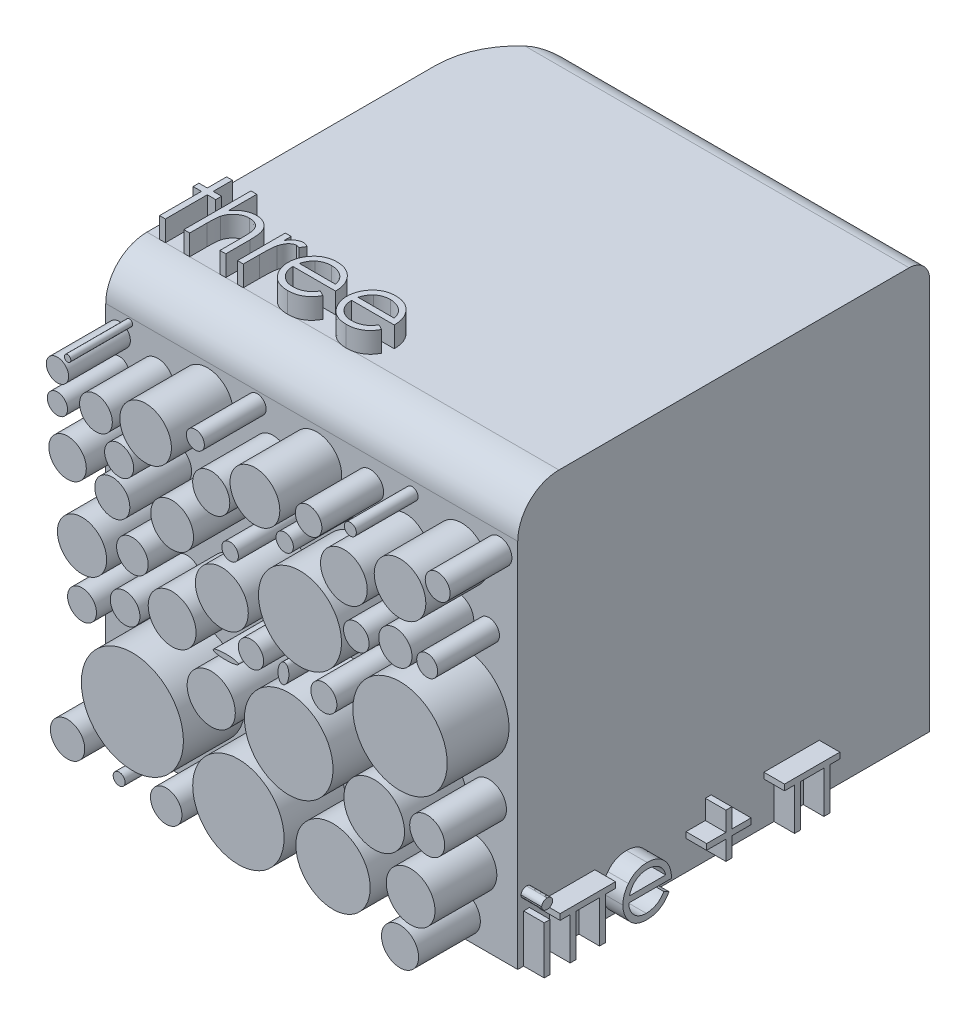
from build123d import *
from OCP.BRepFilletAPI import BRepFilletAPI_MakeFillet

# Parameters (mm, degrees)
SKETCH2_W           = 20
SKETCH2_H           = 20
BOSS_EXTRUDE1_DEPTH = 20
SKETCH3_W           = 0.284935898
SKETCH3_H           = 2.320192308
BOSS_EXTRUDE2_DEPTH = 1
FILLET1_R1          = 2
FILLET1_R2          = 1
FILLET1_R3          = 4
BOSS_EXTRUDE3_DEPTH = 1
SKETCH5_R           = 0.869274054
SKETCH5_R_2         = 1.87334708
SKETCH5_R_3         = 1.224259222
SKETCH5_R_4         = 0.854359486
SKETCH5_R_5         = 0.723058737
SKETCH5_R_6         = 0.828150602
SKETCH5_R_7         = 1.20534194
SKETCH5_R_8         = 2.196982283
SKETCH5_R_9         = 1.648859169
SKETCH5_R_10        = 0.887298728
SKETCH5_R_11        = 1.198491665
SKETCH5_R_12        = 1.240938395
SKETCH5_R_13        = 1.52286101
SKETCH5_R_14        = 2.08407997
SKETCH5_R_15        = 1.116428312
SKETCH5_R_16        = 0.510356374
SKETCH5_R_17        = 0.928303522
SKETCH5_R_18        = 1.048285303
SKETCH5_R_19        = 1.120954627
SKETCH5_R_20        = 1.035138007
SKETCH5_R_21        = 1.063032749
SKETCH5_R_22        = 0.901829478
SKETCH5_R_23        = 0.83084329
SKETCH5_R_24        = 0.806786337
SKETCH5_R_25        = 0.775997991
SKETCH5_R_26        = 0.848871038
SKETCH5_R_27        = 0.739481873
SKETCH5_R_28        = 1.066466648
SKETCH5_R_29        = 0.843889534
SKETCH5_R_30        = 0.704115082
SKETCH5_R_31        = 0.319725843
SKETCH5_R_32        = 0.681387214
SKETCH5_R_33        = 0.790534868
SKETCH5_R_34        = 0.573713006
SKETCH5_R_35        = 0.533233324
SKETCH5_R_36        = 0.625054899
SKETCH5_R_37        = 0.340042365
SKETCH5_R_38        = 0.519725647
SKETCH5_R_39        = 0.813729973
SKETCH5_R_40        = 0.720290961
SKETCH5_R_41        = 0.811333119
SKETCH5_R_42        = 0.907849135
SKETCH5_R_43        = 0.760866236
SKETCH5_R_44        = 0.443440105
SKETCH5_R_45        = 0.505502597
SKETCH5_R_46        = 0.653372918
SKETCH5_R_47        = 0.821463246
SKETCH5_R_48        = 0.243410693
SKETCH5_R_49        = 0.331818637
SKETCH5_R_50        = 0.58557289
SKETCH5_R_51        = 0.913548579
SKETCH5_R_52        = 0.618089992
SKETCH5_R_53        = 0.33645039
SKETCH5_R_54        = 0.353045631
SKETCH5_R_55        = 0.558214156
SKETCH5_R_56        = 0.708578995
SKETCH5_R_57        = 0.386937988
SKETCH5_R_58        = 0.620695254
SKETCH5_R_59        = 0.450911284
SKETCH5_R_60        = 0.446571325
SKETCH5_R_61        = 0.637073751
SKETCH5_R_62        = 0.354108624
SKETCH5_R_63        = 0.719749999
SKETCH5_RX          = 0.571418379
SKETCH5_RY          = 0.334928494
BOSS_EXTRUDE4_DEPTH = 4
SKETCH6_R           = 0.794272448
SKETCH6_R_2         = 0.85045789
SKETCH6_R_3         = 0.901030327
SKETCH6_R_4         = 1.16174239
SKETCH6_R_5         = 1.038098205
SKETCH6_R_6         = 2.014765062
SKETCH6_R_7         = 2.14961737
SKETCH6_R_8         = 2.477089822
SKETCH6_R_9         = 1.183351901
SKETCH6_R_10        = 2.217815956
SKETCH6_R_11        = 1.803840094
SKETCH6_R_12        = 1.195092222
SKETCH6_R_13        = 0.702366469
SKETCH6_R_14        = 1.252556633
SKETCH6_R_15        = 2.290309651
SKETCH6_R_16        = 1.471259211
SKETCH6_R_17        = 1.284780558
SKETCH6_R_18        = 1.169284811
SKETCH6_R_19        = 0.719100487
SKETCH6_R_20        = 0.910166483
SKETCH6_R_21        = 1.250904183
SKETCH6_R_22        = 0.643183028
SKETCH6_R_23        = 1.207146771
SKETCH6_R_24        = 1.133501294
SKETCH6_R_25        = 0.806547414
SKETCH6_R_26        = 0.403167986
SKETCH6_R_27        = 0.767115422
SKETCH6_R_28        = 0.492725753
SKETCH6_R_29        = 0.157493034
SKETCH6_R_30        = 0.541714877
SKETCH6_R_31        = 0.436948105
SKETCH6_R_32        = 0.614399725
SKETCH6_R_33        = 0.834280538
SKETCH6_R_34        = 0.764414303
SKETCH6_R_35        = 0.289432363
SKETCH6_R_36        = 0.90045624
SKETCH6_R_37        = 0.84902596
SKETCH6_R_38        = 0.633160864
SKETCH6_R_39        = 0.705305254
SKETCH6_R_40        = 0.508480831
SKETCH6_R_41        = 0.621454766
SKETCH6_R_42        = 0.603096786
SKETCH6_R_43        = 0.422088862
SKETCH6_RX          = 0.486141315
SKETCH6_RY          = 0.259275368
SKETCH6_RX_2        = 0.611023877
SKETCH6_RY_2        = 0.128636606
BOSS_EXTRUDE5_DEPTH = 3


with BuildPart() as part:
    # Sketch2 → Boss-Extrude1 (new body)
    with BuildSketch(Plane(origin=(0, 0, 0), x_dir=(1, 0, 0), z_dir=(0, 1, 0))):
        with Locations((10, -10)):
            Rectangle(SKETCH2_W, SKETCH2_H)
    extrude(amount=BOSS_EXTRUDE1_DEPTH)

    # Sketch3 → Boss-Extrude2 (add)
    # profile 1 of 6: a face of its own
    with BuildSketch(Plane(origin=(20, 0, 0), x_dir=(0, 0, -1), z_dir=(1, 0, 0))):
        with BuildLine():
            add(Edge.make_bspline(
                [(-19.573868189, 3.297115385), (-19.556186781, 3.296295189), (-19.521563189, 3.294689089), (-19.47149501, 3.280935463), (-19.425904721, 3.257622177), (-19.385466349, 3.226344181), (-19.350766423, 3.189560043), (-19.326472493, 3.146687593), (-19.310858391, 3.100370114), (-19.308972844, 3.06806214), (-19.308012821, 3.05161258)],
                knots=[0, 0, 0, 0, 1.055194115, 2.066272739, 3.074728998, 4.095836921, 5.109056067, 6.073838105, 7.019297344, 8, 8, 8, 8], degree=3))
            add(Edge.make_bspline(
                [(-19.308012821, 3.05161258), (-19.308994494, 3.03559003), (-19.310935147, 3.003915346), (-19.326460432, 2.958400839), (-19.350973462, 2.916124096), (-19.385444098, 2.879411381), (-19.425910617, 2.848150675), (-19.471493444, 2.824832805), (-19.521563601, 2.811080395), (-19.55618692, 2.809474127), (-19.573868189, 2.808653846)],
                knots=[0, 0, 0, 0, 0.96129708, 1.900370562, 2.859976407, 3.87933698, 4.906634145, 5.921202961, 6.938410037, 8, 8, 8, 8], degree=3))
            add(Edge.make_bspline(
                [(-19.573868189, 2.808653846), (-19.591347267, 2.809442807), (-19.625368009, 2.810978415), (-19.674686502, 2.825102646), (-19.71988806, 2.848158655), (-19.760405299, 2.879206694), (-19.794178403, 2.916349565), (-19.818760455, 2.958375039), (-19.834249885, 3.003921915), (-19.836195369, 3.035592237), (-19.837179487, 3.05161258)],
                knots=[0, 0, 0, 0, 1.054934014, 2.053291228, 3.073705704, 4.106921865, 5.123545215, 6.088680038, 7.033164197, 8, 8, 8, 8], degree=3))
            add(Edge.make_bspline(
                [(-19.837179487, 3.05161258), (-19.83621693, 3.068059851), (-19.834326407, 3.100363328), (-19.818748845, 3.146713822), (-19.794383162, 3.189332756), (-19.760382936, 3.226548745), (-19.719894012, 3.257614247), (-19.674684964, 3.280665637), (-19.625368416, 3.294791066), (-19.591347405, 3.296326509), (-19.573868189, 3.297115385)],
                knots=[0, 0, 0, 0, 0.98631895, 1.937192651, 2.907499808, 3.917963147, 4.944918757, 5.95915025, 6.951458133, 8, 8, 8, 8], degree=3))
        make_face()
    # profile 2 of 6: a face of its own
    with BuildSketch(Plane(origin=(20, 0, 0), x_dir=(0, 0, -1), z_dir=(1, 0, 0))):
        with Locations((-19.572596154, 1.160096154)):
            Rectangle(SKETCH3_W, SKETCH3_H)
    # profile 3 of 6: a face of its own
    with BuildSketch(Plane(origin=(20, 0, 0), x_dir=(0, 0, -1), z_dir=(1, 0, 0))):
        Polygon((-16.256585145, 2.03525641), (-16.745046683, 2.03525641), (-16.745046683, 0), (-17.029982581, 0), (-17.029982581, 2.03525641), (-18.169726171, 2.03525641), (-18.169726171, 0), (-18.454662068, 0), (-18.454662068, 2.03525641), (-18.943123606, 2.03525641), (-18.943123606, 2.320192308), (-16.256585145, 2.320192308), align=None)
    # profile 4 of 6: a face of its own
    with BuildSketch(Plane(origin=(20, 0, 0), x_dir=(0, 0, -1), z_dir=(1, 0, 0))):
        with BuildLine():
            Line((-13.909152811, 0.732692308), (-13.656017795, 0.599764623))
            add(Edge.make_bspline(
                [(-13.656017795, 0.599764623), (-13.676189563, 0.563983887), (-13.715435837, 0.494368744), (-13.782927944, 0.398726985), (-13.853677895, 0.312686557), (-13.930879352, 0.238546085), (-14.012222561, 0.1739109), (-14.098158612, 0.117361587), (-14.189134897, 0.069175501), (-14.285155718, 0.028578565), (-14.387027454, -0.002635762), (-14.494996972, -0.024683162), (-14.609271115, -0.038311413), (-14.687599435, -0.039894505), (-14.727707498, -0.040705128)],
                knots=[0, 0, 0, 0, 1.120438281, 2.179929193, 3.190490725, 4.156257408, 5.095198341, 6.022838206, 6.959905092, 7.901321166, 8.864066838, 9.862729781, 10.905609505, 12, 12, 12, 12], degree=3))
            add(Edge.make_bspline(
                [(-14.727707498, -0.040705128), (-14.772286292, -0.039664476), (-14.859246605, -0.037634466), (-14.985829089, -0.020133445), (-15.10500899, 0.008416481), (-15.216779607, 0.048299508), (-15.320867222, 0.100394295), (-15.417478712, 0.163857539), (-15.507122139, 0.238363227), (-15.586972671, 0.324556715), (-15.658858193, 0.416796776), (-15.722290902, 0.5129139), (-15.775320143, 0.612666254), (-15.818457153, 0.7154188), (-15.853295852, 0.820523904), (-15.877577076, 0.928937878), (-15.891574062, 1.040367301), (-15.893718952, 1.115748455), (-15.894799846, 1.153735978)],
                knots=[0, 0, 0, 0, 1.145258523, 2.234067595, 3.276747158, 4.290159414, 5.277019952, 6.260822364, 7.254936242, 8.264827045, 9.274100331, 10.257902744, 11.220704747, 12.172965371, 13.118907548, 14.062713208, 15.023725156, 16, 16, 16, 16], degree=3))
            add(Edge.make_bspline(
                [(-15.894799846, 1.153735978), (-15.893839054, 1.189382002), (-15.89193489, 1.260027716), (-15.879932675, 1.364590031), (-15.858661724, 1.466215842), (-15.829473201, 1.564989591), (-15.791780285, 1.660745898), (-15.745668201, 1.753543042), (-15.691065115, 1.843282276), (-15.648907761, 1.899890833), (-15.627672442, 1.928405449)],
                knots=[0, 0, 0, 0, 1.024358464, 2.0301432, 3.019427413, 4.004406732, 4.986367066, 5.972626655, 6.978780325, 8, 8, 8, 8], degree=3))
            add(Edge.make_bspline(
                [(-15.627672442, 1.928405449), (-15.598909044, 1.962757924), (-15.5422934, 2.030374674), (-15.446538706, 2.119218727), (-15.342852099, 2.193644152), (-15.232532981, 2.25533634), (-15.11429918, 2.302211719), (-14.989740037, 2.337143598), (-14.857437256, 2.356717936), (-14.766990377, 2.359482757), (-14.720711304, 2.360897436)],
                knots=[0, 0, 0, 0, 1.030682036, 2.02871468, 2.997146059, 3.962720338, 4.930598197, 5.918074684, 6.934738563, 8, 8, 8, 8], degree=3))
            add(Edge.make_bspline(
                [(-14.720711304, 2.360897436), (-14.673133834, 2.35966912), (-14.579797682, 2.357259445), (-14.443697115, 2.334919842), (-14.314918465, 2.299493596), (-14.193513265, 2.249461229), (-14.079469206, 2.18490935), (-13.973527575, 2.104952108), (-13.87387656, 2.012044272), (-13.815902349, 1.940594789), (-13.786401409, 1.904236779)],
                knots=[0, 0, 0, 0, 1.056321875, 2.072262726, 3.055038591, 4.01806755, 4.982017516, 5.957941055, 6.960871419, 8, 8, 8, 8], degree=3))
            add(Edge.make_bspline(
                [(-13.786401409, 1.904236779), (-13.766329115, 1.876837816), (-13.726318134, 1.822222265), (-13.676201121, 1.733167001), (-13.632696913, 1.639993819), (-13.597923441, 1.541196621), (-13.56976618, 1.437946002), (-13.549394637, 1.329503836), (-13.537447911, 1.215902417), (-13.535099593, 1.138499042), (-13.53390241, 1.099038462)],
                knots=[0, 0, 0, 0, 0.94817472, 1.890038105, 2.849395472, 3.817997239, 4.812318967, 5.836947057, 6.897266129, 8, 8, 8, 8], degree=3))
            Line((-13.53390241, 1.099038462), (-15.609863949, 1.099038462))
            add(Edge.make_bspline(
                [(-15.609863949, 1.099038462), (-15.608467306, 1.068467326), (-15.605720864, 1.008350421), (-15.592916412, 0.920384068), (-15.572733596, 0.836588251), (-15.544368089, 0.757591491), (-15.510017451, 0.682362018), (-15.467938979, 0.611457885), (-15.417738098, 0.545202048), (-15.361744071, 0.483001859), (-15.29941692, 0.427611026), (-15.233846142, 0.378034057), (-15.164092694, 0.336481837), (-15.090706576, 0.302754366), (-15.013806456, 0.276350779), (-14.933368108, 0.258327828), (-14.849549816, 0.246256381), (-14.792412758, 0.244914113), (-14.763324485, 0.244230769)],
                knots=[0, 0, 0, 0, 1.094153842, 2.151609401, 3.174256925, 4.172055639, 5.149267565, 6.128595816, 7.11444997, 8.118368179, 9.117203808, 10.09244225, 11.054858984, 12.015122123, 12.976791628, 13.957293641, 14.960065497, 16, 16, 16, 16], degree=3))
            add(Edge.make_bspline(
                [(-14.763324485, 0.244230769), (-14.734884516, 0.244782363), (-14.678454161, 0.245876832), (-14.594415669, 0.256519351), (-14.511739097, 0.273728102), (-14.430766634, 0.297214021), (-14.353141652, 0.325858737), (-14.281254617, 0.360423472), (-14.21514185, 0.398659314), (-14.153350031, 0.442392376), (-14.093414201, 0.495921231), (-14.033957803, 0.56271935), (-13.970206839, 0.641720179), (-13.930301994, 0.701179461), (-13.909152811, 0.732692308)],
                knots=[0, 0, 0, 0, 0.99110716, 1.966546729, 2.947904876, 3.932708344, 4.903319531, 5.828989031, 6.710028674, 7.56322171, 8.463672341, 9.504779593, 10.677557249, 12, 12, 12, 12], degree=3))
        make_face()
        with BuildLine():
            add(Edge.make_bspline(
                [(-13.818838308, 1.383974359), (-13.829267388, 1.421768537), (-13.849340012, 1.494510165), (-13.891283, 1.595240115), (-13.938519326, 1.68476414), (-13.994419039, 1.762397092), (-14.057754598, 1.831343136), (-14.130911299, 1.891594282), (-14.212949574, 1.945494398), (-14.303445366, 1.990989879), (-14.399277556, 2.02971568), (-14.499613173, 2.055682749), (-14.60199131, 2.073471405), (-14.671237412, 2.075127947), (-14.706082899, 2.075961538)],
                knots=[0, 0, 0, 0, 1.154881502, 2.222775134, 3.210006277, 4.132804581, 5.035138423, 5.962687519, 6.919655026, 7.923214229, 8.944639381, 9.960483929, 10.97369054, 12, 12, 12, 12], degree=3))
            add(Edge.make_bspline(
                [(-14.706082899, 2.075961538), (-14.734521318, 2.075406665), (-14.790738094, 2.074309797), (-14.873561206, 2.063904751), (-14.953099219, 2.046705463), (-15.029939015, 2.023151538), (-15.10307366, 1.991756592), (-15.174007485, 1.954941807), (-15.240936845, 1.910000514), (-15.282793592, 1.875747838), (-15.303939469, 1.85844351)],
                knots=[0, 0, 0, 0, 1.04873581, 2.073130211, 3.073294108, 4.04793562, 5.032784715, 6.005352987, 6.992311501, 8, 8, 8, 8], degree=3))
            add(Edge.make_bspline(
                [(-15.303939469, 1.85844351), (-15.319082661, 1.844750809), (-15.34972879, 1.81704012), (-15.390677691, 1.769297911), (-15.429884835, 1.717816137), (-15.465566077, 1.660625203), (-15.498293602, 1.598376353), (-15.528918724, 1.531594641), (-15.55648354, 1.459773302), (-15.571992154, 1.409724017), (-15.57997112, 1.383974359)],
                knots=[0, 0, 0, 0, 0.879870761, 1.780643979, 2.707998968, 3.669668524, 4.684282772, 5.740141944, 6.837334558, 8, 8, 8, 8], degree=3))
            Line((-15.57997112, 1.383974359), (-13.818838308, 1.383974359))
        make_face(mode=Mode.SUBTRACT)
    # profile 5 of 6: a face of its own
    with BuildSketch(Plane(origin=(20, 0, 0), x_dir=(0, 0, -1), z_dir=(1, 0, 0))):
        Polygon((-10.894403598, 1.709615385), (-10.894403598, 2.645833333), (-10.6094677, 2.645833333), (-10.6094677, 1.709615385), (-9.673249751, 1.709615385), (-9.673249751, 1.424679487), (-10.6094677, 1.424679487), (-10.6094677, 0.488461538), (-10.894403598, 0.488461538), (-10.894403598, 1.424679487), (-11.830621546, 1.424679487), (-11.830621546, 1.709615385), align=None)
    # profile 6 of 6: a face of its own
    with BuildSketch(Plane(origin=(20, 0, 0), x_dir=(0, 0, -1), z_dir=(1, 0, 0))):
        Polygon((-5.364587302, 2.03525641), (-5.85304884, 2.03525641), (-5.85304884, 0), (-6.137984738, 0), (-6.137984738, 2.03525641), (-7.277728327, 2.03525641), (-7.277728327, 0), (-7.562664225, 0), (-7.562664225, 2.03525641), (-8.051125763, 2.03525641), (-8.051125763, 2.320192308), (-5.364587302, 2.320192308), align=None)
    extrude(amount=BOSS_EXTRUDE2_DEPTH)

    # Fillet1: one fillet with a radius per group of edges: ONE call of the kernel's fillet builder (fillet() takes one radius for all edges)
    fillet1_edges_1 = [part.edges().sort_by_distance(p)[0] for p in [
        (10, 20, 20),
    ]]
    fillet1_edges_2 = [part.edges().sort_by_distance(p)[0] for p in [
        (10, 20, 0),
    ]]
    fillet1_edges_3 = [part.edges().sort_by_distance(p)[0] for p in [
        (0, 10, 0),
    ]]
    fillet1 = BRepFilletAPI_MakeFillet(part.part.solid().wrapped)
    for e in fillet1_edges_1:
        fillet1.Add(FILLET1_R1, e.wrapped)
    for e in fillet1_edges_2:
        fillet1.Add(FILLET1_R2, e.wrapped)
    for e in fillet1_edges_3:
        fillet1.Add(FILLET1_R3, e.wrapped)
    add(Compound.cast(fillet1.Shape()), mode=Mode.REPLACE)

    # Sketch4 → Boss-Extrude3 (add)
    # profile 1 of 5: a face of its own
    with BuildSketch(Plane(origin=(0, 20, 0), x_dir=(1, 0, 0), z_dir=(0, 1, 0))):
        Polygon((0.610576923, -14.743589744), (0.895512821, -14.743589744), (0.895512821, -15.679807692), (1.302564103, -15.679807692), (1.302564103, -15.96474359), (0.895512821, -15.96474359), (0.895512821, -18), (0.610576923, -18), (0.610576923, -15.96474359), (0.203525641, -15.96474359), (0.203525641, -15.679807692), (0.610576923, -15.679807692), align=None)
    # profile 2 of 5: a face of its own
    with BuildSketch(Plane(origin=(0, 20, 0), x_dir=(1, 0, 0), z_dir=(0, 1, 0))):
        with BuildLine():
            Line((1.791025641, -14.743589744), (2.075961538, -14.743589744))
            Line((2.075961538, -14.743589744), (2.075961538, -16.118023838))
            add(Edge.make_bspline(
                [(2.075961538, -16.118023838), (2.106547948, -16.079793226), (2.166101254, -16.005356265), (2.266337017, -15.90823647), (2.369271308, -15.824054864), (2.478459386, -15.757043806), (2.591898072, -15.704106085), (2.710065807, -15.666561577), (2.832984545, -15.643473796), (2.916464502, -15.640572374), (2.958754006, -15.639102564)],
                knots=[0, 0, 0, 0, 1.125788106, 2.19196713, 3.20547328, 4.180437432, 5.132270164, 6.079753143, 7.027236121, 8, 8, 8, 8], degree=3))
            add(Edge.make_bspline(
                [(2.958754006, -15.639102564), (3.001689434, -15.640685919), (3.085724423, -15.643784926), (3.208081178, -15.668289921), (3.322345686, -15.710161311), (3.428178272, -15.767462827), (3.523269248, -15.83883032), (3.607497248, -15.921227487), (3.676295687, -16.01672597), (3.723103457, -16.104951286), (3.753559334, -16.183454299), (3.772837777, -16.250797421), (3.789183764, -16.325838013), (3.803425667, -16.408537449), (3.81291763, -16.499292712), (3.82054182, -16.597694357), (3.825963317, -16.703736743), (3.826173416, -16.777142969), (3.826282051, -16.815099159)],
                knots=[0, 0, 0, 0, 1.235656852, 2.418478516, 3.575258207, 4.727955599, 5.870717718, 6.98870536, 8.107142894, 9.245821548, 9.854588956, 10.528768408, 11.260415777, 12.065282286, 12.943670737, 13.886611085, 14.907229059, 16, 16, 16, 16], degree=3))
            Line((3.826282051, -16.815099159), (3.826282051, -18))
            Line((3.826282051, -18), (3.541346154, -18))
            Line((3.541346154, -18), (3.541346154, -16.90859375))
            add(Edge.make_bspline(
                [(3.541346154, -16.90859375), (3.541173522, -16.877004614), (3.540843306, -16.816579973), (3.5397517, -16.730069289), (3.537314919, -16.651604938), (3.53337717, -16.581438389), (3.529235784, -16.519471821), (3.523535918, -16.465795221), (3.516904491, -16.420334868), (3.510945668, -16.392971241), (3.508273237, -16.380699119)],
                knots=[0, 0, 0, 0, 1.430932559, 2.737130458, 3.918967929, 4.986496826, 5.920444988, 6.731744033, 7.431208747, 8, 8, 8, 8], degree=3))
            add(Edge.make_bspline(
                [(3.508273237, -16.380699119), (3.497909815, -16.344690751), (3.477986196, -16.275464874), (3.431678388, -16.181428259), (3.373839856, -16.101250672), (3.303221269, -16.03601414), (3.221071896, -15.984840815), (3.126856071, -15.949400755), (3.021460524, -15.927404607), (2.947209546, -15.925191811), (2.908508614, -15.924038462)],
                knots=[0, 0, 0, 0, 1.090059168, 2.095632401, 3.037101401, 3.955032261, 4.878929692, 5.839099886, 6.873700383, 8, 8, 8, 8], degree=3))
            add(Edge.make_bspline(
                [(2.908508614, -15.924038462), (2.885587134, -15.924470104), (2.840226117, -15.925324313), (2.772962685, -15.93390035), (2.707712748, -15.947914544), (2.643847916, -15.966877947), (2.582721729, -15.992682113), (2.522552463, -16.022554499), (2.465044859, -16.059119844), (2.409177725, -16.100146076), (2.357182534, -16.145566501), (2.308807222, -16.193506239), (2.265683157, -16.244555671), (2.226613792, -16.297895776), (2.192887776, -16.354258189), (2.163448194, -16.413099392), (2.138469384, -16.474496767), (2.126057227, -16.517109858), (2.119846755, -16.53843149)],
                knots=[0, 0, 0, 0, 1.024319606, 2.027102035, 3.025350316, 4.005802111, 5.00026367, 5.987881639, 7.005602596, 8.042517216, 9.083927026, 10.089214625, 11.084353441, 12.06828073, 13.041928858, 14.016821737, 15.00770877, 16, 16, 16, 16], degree=3))
            add(Edge.make_bspline(
                [(2.119846755, -16.53843149), (2.116273132, -16.553871924), (2.108485767, -16.587518531), (2.100035882, -16.643012382), (2.092472309, -16.707497876), (2.086078268, -16.780877207), (2.082156611, -16.863419262), (2.077930921, -16.954560775), (2.076357923, -17.054872651), (2.076097615, -17.124627861), (2.075961538, -17.161092748)],
                knots=[0, 0, 0, 0, 0.607992626, 1.324890765, 2.152360218, 3.099583803, 4.150613268, 5.323148443, 6.60066238, 8, 8, 8, 8], degree=3))
            Line((2.075961538, -17.161092748), (2.075961538, -18))
            Line((2.075961538, -18), (1.791025641, -18))
            Line((1.791025641, -18), (1.791025641, -14.743589744))
        make_face()
    # profile 3 of 5: a face of its own
    with BuildSketch(Plane(origin=(0, 20, 0), x_dir=(1, 0, 0), z_dir=(0, 1, 0))):
        with BuildLine():
            Line((4.396153846, -15.679807692), (4.681089744, -15.679807692))
            Line((4.681089744, -15.679807692), (4.681089744, -16.021349159))
            add(Edge.make_bspline(
                [(4.681089744, -16.021349159), (4.70212526, -15.989548514), (4.742355523, -15.928730029), (4.80922368, -15.848294306), (4.877715988, -15.781696371), (4.948160337, -15.728625322), (5.021074756, -15.688880564), (5.09485899, -15.659767597), (5.170673881, -15.642552461), (5.221620769, -15.64025407), (5.247145433, -15.639102564)],
                knots=[0, 0, 0, 0, 1.2804753, 2.448899062, 3.506932113, 4.484331642, 5.4025378, 6.288909075, 7.142734305, 8, 8, 8, 8], degree=3))
            add(Edge.make_bspline(
                [(5.247145433, -15.639102564), (5.266945029, -15.640182542), (5.307683985, -15.642404666), (5.369353905, -15.658017343), (5.432893323, -15.682943835), (5.473843917, -15.706384608), (5.495192308, -15.718604768)],
                knots=[0, 0, 0, 0, 0.901110191, 1.854092781, 2.881294221, 4, 4, 4, 4], degree=3))
            Line((5.495192308, -15.718604768), (5.338731971, -15.965379607))
            add(Edge.make_bspline(
                [(5.338731971, -15.965379607), (5.325025931, -15.959265223), (5.299009242, -15.947658951), (5.260950457, -15.933922985), (5.225860958, -15.925834976), (5.20350573, -15.924609682), (5.193083934, -15.924038462)],
                knots=[0, 0, 0, 0, 1.180555205, 2.24091978, 3.179933427, 4, 4, 4, 4], degree=3))
            add(Edge.make_bspline(
                [(5.193083934, -15.924038462), (5.170218733, -15.925562495), (5.123580351, -15.928671083), (5.055105126, -15.95310843), (4.988659447, -15.992592041), (4.935889439, -16.036380835), (4.895029681, -16.078606337), (4.865873905, -16.115480245), (4.839128842, -16.156826575), (4.813574428, -16.201938502), (4.790291432, -16.251586291), (4.768561125, -16.305273921), (4.748913442, -16.363063573), (4.737710006, -16.403324859), (4.731971154, -16.423948317)],
                knots=[0, 0, 0, 0, 1.125678352, 2.296057538, 3.5422874, 4.923748041, 5.663163013, 6.437101912, 7.23742474, 8.08941207, 8.991984279, 9.93940061, 10.944477711, 12, 12, 12, 12], degree=3))
            add(Edge.make_bspline(
                [(4.731971154, -16.423948317), (4.727678197, -16.44234261), (4.718169624, -16.483084572), (4.708924443, -16.551436448), (4.699789952, -16.632193624), (4.693352305, -16.725580891), (4.687385081, -16.831365036), (4.684019507, -16.949707215), (4.681204515, -17.080728898), (4.681129161, -17.172327062), (4.681089744, -17.220242388)],
                knots=[0, 0, 0, 0, 0.566838948, 1.255505196, 2.06880316, 3.007127437, 4.065329342, 5.249902469, 6.561414163, 8, 8, 8, 8], degree=3))
            Line((4.681089744, -17.220242388), (4.681089744, -18))
            Line((4.681089744, -18), (4.396153846, -18))
            Line((4.396153846, -18), (4.396153846, -15.679807692))
        make_face()
    # profile 4 of 5: a face of its own
    with BuildSketch(Plane(origin=(0, 20, 0), x_dir=(1, 0, 0), z_dir=(0, 1, 0))):
        with BuildLine():
            Line((7.684364984, -17.267307692), (7.9375, -17.400235377))
            add(Edge.make_bspline(
                [(7.9375, -17.400235377), (7.917328231, -17.436016113), (7.878081958, -17.505631256), (7.810589851, -17.601273015), (7.739839899, -17.687313443), (7.662638443, -17.761453915), (7.581295234, -17.8260891), (7.495359183, -17.882638413), (7.404382898, -17.930824499), (7.308362076, -17.971421435), (7.206490341, -18.002635762), (7.098520822, -18.024683162), (6.98424668, -18.038311413), (6.90591836, -18.039894505), (6.865810296, -18.040705128)],
                knots=[0, 0, 0, 0, 1.120438281, 2.179929193, 3.190490725, 4.156257408, 5.095198341, 6.022838206, 6.959905092, 7.901321166, 8.864066838, 9.862729781, 10.905609505, 12, 12, 12, 12], degree=3))
            add(Edge.make_bspline(
                [(6.865810296, -18.040705128), (6.821231503, -18.039664476), (6.73427119, -18.037634466), (6.607688705, -18.020133445), (6.488508804, -17.991583519), (6.376738188, -17.951700492), (6.272650573, -17.899605705), (6.176039083, -17.836142461), (6.086395656, -17.761636773), (6.006545124, -17.675443285), (5.934659601, -17.583203224), (5.871226893, -17.4870861), (5.818197652, -17.387333746), (5.775060642, -17.2845812), (5.740221943, -17.179476096), (5.715940718, -17.071062122), (5.701943733, -16.959632699), (5.699798843, -16.884251545), (5.698717949, -16.846264022)],
                knots=[0, 0, 0, 0, 1.145258523, 2.234067595, 3.276747158, 4.290159414, 5.277019952, 6.260822364, 7.254936242, 8.264827045, 9.274100331, 10.257902744, 11.220704747, 12.172965371, 13.118907548, 14.062713208, 15.023725156, 16, 16, 16, 16], degree=3))
            add(Edge.make_bspline(
                [(5.698717949, -16.846264022), (5.699678741, -16.810617998), (5.701582905, -16.739972284), (5.713585119, -16.635409969), (5.734856071, -16.533784158), (5.764044593, -16.435010409), (5.80173751, -16.339254102), (5.847849594, -16.246456958), (5.90245268, -16.156717724), (5.944610034, -16.100109167), (5.965845353, -16.071594551)],
                knots=[0, 0, 0, 0, 1.024358464, 2.0301432, 3.019427413, 4.004406732, 4.986367066, 5.972626655, 6.978780325, 8, 8, 8, 8], degree=3))
            add(Edge.make_bspline(
                [(5.965845353, -16.071594551), (5.994608751, -16.037242076), (6.051224395, -15.969625326), (6.146979089, -15.880781273), (6.250665695, -15.806355848), (6.360984813, -15.74466366), (6.479218615, -15.697788281), (6.603777757, -15.662856402), (6.736080539, -15.643282064), (6.826527418, -15.640517243), (6.87280649, -15.639102564)],
                knots=[0, 0, 0, 0, 1.030682036, 2.02871468, 2.997146059, 3.962720338, 4.930598197, 5.918074684, 6.934738563, 8, 8, 8, 8], degree=3))
            add(Edge.make_bspline(
                [(6.87280649, -15.639102564), (6.920383961, -15.64033088), (7.013720113, -15.642740555), (7.14982068, -15.665080158), (7.27859933, -15.700506404), (7.40000453, -15.750538771), (7.514048589, -15.81509065), (7.61999022, -15.895047892), (7.719641235, -15.987955728), (7.777615446, -16.059405211), (7.807116386, -16.095763221)],
                knots=[0, 0, 0, 0, 1.056321875, 2.072262726, 3.055038591, 4.01806755, 4.982017516, 5.957941055, 6.960871419, 8, 8, 8, 8], degree=3))
            add(Edge.make_bspline(
                [(7.807116386, -16.095763221), (7.82718868, -16.123162184), (7.867199661, -16.177777735), (7.917316673, -16.266832999), (7.960820882, -16.360006181), (7.995594353, -16.458803379), (8.023751615, -16.562053998), (8.044123158, -16.670496164), (8.056069883, -16.784097583), (8.058418202, -16.861500958), (8.059615385, -16.900961538)],
                knots=[0, 0, 0, 0, 0.94817472, 1.890038105, 2.849395472, 3.817997239, 4.812318967, 5.836947057, 6.897266129, 8, 8, 8, 8], degree=3))
            Line((8.059615385, -16.900961538), (5.983653846, -16.900961538))
            add(Edge.make_bspline(
                [(5.983653846, -16.900961538), (5.985050489, -16.931532674), (5.987796931, -16.991649579), (6.000601383, -17.079615932), (6.020784199, -17.163411749), (6.049149706, -17.242408509), (6.083500344, -17.317637982), (6.125578815, -17.388542115), (6.175779696, -17.454797952), (6.231773724, -17.516998141), (6.294100875, -17.572388974), (6.359671652, -17.621965943), (6.429425101, -17.663518163), (6.502811219, -17.697245634), (6.579711339, -17.723649221), (6.660149687, -17.741672172), (6.743967978, -17.753743619), (6.801105037, -17.755085887), (6.830193309, -17.755769231)],
                knots=[0, 0, 0, 0, 1.094153842, 2.151609401, 3.174256925, 4.172055639, 5.149267565, 6.128595816, 7.11444997, 8.118368179, 9.117203808, 10.09244225, 11.054858984, 12.015122123, 12.976791628, 13.957293641, 14.960065497, 16, 16, 16, 16], degree=3))
            add(Edge.make_bspline(
                [(6.830193309, -17.755769231), (6.858633279, -17.755217637), (6.915063634, -17.754123168), (6.999102126, -17.743480649), (7.081778698, -17.726271898), (7.162751161, -17.702785979), (7.240376143, -17.674141263), (7.312263177, -17.639576528), (7.378375944, -17.601340686), (7.440167764, -17.557607624), (7.500103594, -17.504078769), (7.559559992, -17.43728065), (7.623310956, -17.358279821), (7.663215801, -17.298820539), (7.684364984, -17.267307692)],
                knots=[0, 0, 0, 0, 0.99110716, 1.966546729, 2.947904876, 3.932708344, 4.903319531, 5.828989031, 6.710028674, 7.56322171, 8.463672341, 9.504779593, 10.677557249, 12, 12, 12, 12], degree=3))
        make_face()
        with BuildLine():
            add(Edge.make_bspline(
                [(7.774679487, -16.616025641), (7.764250406, -16.578231463), (7.744177783, -16.505489835), (7.702234795, -16.404759885), (7.654998469, -16.31523586), (7.599098755, -16.237602908), (7.535763197, -16.168656864), (7.462606496, -16.108405718), (7.380568221, -16.054505602), (7.290072429, -16.009010121), (7.194240238, -15.97028432), (7.093904621, -15.944317251), (6.991526485, -15.926528595), (6.922280383, -15.924872053), (6.887434896, -15.924038462)],
                knots=[0, 0, 0, 0, 1.154881502, 2.222775134, 3.210006277, 4.132804581, 5.035138423, 5.962687519, 6.919655026, 7.923214229, 8.944639381, 9.960483929, 10.97369054, 12, 12, 12, 12], degree=3))
            add(Edge.make_bspline(
                [(6.887434896, -15.924038462), (6.858996477, -15.924593335), (6.802779701, -15.925690203), (6.719956589, -15.936095249), (6.640418576, -15.953294537), (6.56357878, -15.976848462), (6.490444135, -16.008243408), (6.419510309, -16.045058193), (6.35258095, -16.089999486), (6.310724203, -16.124252162), (6.289578325, -16.14155649)],
                knots=[0, 0, 0, 0, 1.04873581, 2.073130211, 3.073294108, 4.04793562, 5.032784715, 6.005352987, 6.992311501, 8, 8, 8, 8], degree=3))
            add(Edge.make_bspline(
                [(6.289578325, -16.14155649), (6.274435134, -16.155249191), (6.243789005, -16.18295988), (6.202840103, -16.230702089), (6.16363296, -16.282183863), (6.127951718, -16.339374797), (6.095224193, -16.401623647), (6.064599071, -16.468405359), (6.037034254, -16.540226698), (6.02152564, -16.590275983), (6.013546675, -16.616025641)],
                knots=[0, 0, 0, 0, 0.879870761, 1.780643979, 2.707998968, 3.669668524, 4.684282772, 5.740141944, 6.837334558, 8, 8, 8, 8], degree=3))
            Line((6.013546675, -16.616025641), (7.774679487, -16.616025641))
        make_face(mode=Mode.SUBTRACT)
    # profile 5 of 5: a face of its own
    with BuildSketch(Plane(origin=(0, 20, 0), x_dir=(1, 0, 0), z_dir=(0, 1, 0))):
        with BuildLine():
            Line((10.533723958, -17.267307692), (10.786858974, -17.400235377))
            add(Edge.make_bspline(
                [(10.786858974, -17.400235377), (10.766687206, -17.436016113), (10.727440932, -17.505631256), (10.659948825, -17.601273015), (10.589198874, -17.687313443), (10.511997417, -17.761453915), (10.430654208, -17.8260891), (10.344718157, -17.882638413), (10.253741873, -17.930824499), (10.157721051, -17.971421435), (10.055849315, -18.002635762), (9.947879797, -18.024683162), (9.833605654, -18.038311413), (9.755277334, -18.039894505), (9.715169271, -18.040705128)],
                knots=[0, 0, 0, 0, 1.120438281, 2.179929193, 3.190490725, 4.156257408, 5.095198341, 6.022838206, 6.959905092, 7.901321166, 8.864066838, 9.862729781, 10.905609505, 12, 12, 12, 12], degree=3))
            add(Edge.make_bspline(
                [(9.715169271, -18.040705128), (9.670590477, -18.039664476), (9.583630165, -18.037634466), (9.45704768, -18.020133445), (9.337867779, -17.991583519), (9.226097162, -17.951700492), (9.122009547, -17.899605705), (9.025398058, -17.836142461), (8.93575463, -17.761636773), (8.855904098, -17.675443285), (8.784018576, -17.583203224), (8.720585868, -17.4870861), (8.667556627, -17.387333746), (8.624419616, -17.2845812), (8.589580917, -17.179476096), (8.565299693, -17.071062122), (8.551302707, -16.959632699), (8.549157817, -16.884251545), (8.548076923, -16.846264022)],
                knots=[0, 0, 0, 0, 1.145258523, 2.234067595, 3.276747158, 4.290159414, 5.277019952, 6.260822364, 7.254936242, 8.264827045, 9.274100331, 10.257902744, 11.220704747, 12.172965371, 13.118907548, 14.062713208, 15.023725156, 16, 16, 16, 16], degree=3))
            add(Edge.make_bspline(
                [(8.548076923, -16.846264022), (8.549037716, -16.810617998), (8.550941879, -16.739972284), (8.562944094, -16.635409969), (8.584215045, -16.533784158), (8.613403568, -16.435010409), (8.651096484, -16.339254102), (8.697208568, -16.246456958), (8.751811654, -16.156717724), (8.793969008, -16.100109167), (8.815204327, -16.071594551)],
                knots=[0, 0, 0, 0, 1.024358464, 2.0301432, 3.019427413, 4.004406732, 4.986367066, 5.972626655, 6.978780325, 8, 8, 8, 8], degree=3))
            add(Edge.make_bspline(
                [(8.815204327, -16.071594551), (8.843967725, -16.037242076), (8.900583369, -15.969625326), (8.996338063, -15.880781273), (9.10002467, -15.806355848), (9.210343788, -15.74466366), (9.328577589, -15.697788281), (9.453136732, -15.662856402), (9.585439514, -15.643282064), (9.675886392, -15.640517243), (9.722165465, -15.639102564)],
                knots=[0, 0, 0, 0, 1.030682036, 2.02871468, 2.997146059, 3.962720338, 4.930598197, 5.918074684, 6.934738563, 8, 8, 8, 8], degree=3))
            add(Edge.make_bspline(
                [(9.722165465, -15.639102564), (9.769742935, -15.64033088), (9.863079087, -15.642740555), (9.999179654, -15.665080158), (10.127958304, -15.700506404), (10.249363504, -15.750538771), (10.363407564, -15.81509065), (10.469349194, -15.895047892), (10.569000209, -15.987955728), (10.62697442, -16.059405211), (10.656475361, -16.095763221)],
                knots=[0, 0, 0, 0, 1.056321875, 2.072262726, 3.055038591, 4.01806755, 4.982017516, 5.957941055, 6.960871419, 8, 8, 8, 8], degree=3))
            add(Edge.make_bspline(
                [(10.656475361, -16.095763221), (10.676547655, -16.123162184), (10.716558635, -16.177777735), (10.766675648, -16.266832999), (10.810179856, -16.360006181), (10.844953328, -16.458803379), (10.87311059, -16.562053998), (10.893482132, -16.670496164), (10.905428858, -16.784097583), (10.907777176, -16.861500958), (10.908974359, -16.900961538)],
                knots=[0, 0, 0, 0, 0.94817472, 1.890038105, 2.849395472, 3.817997239, 4.812318967, 5.836947057, 6.897266129, 8, 8, 8, 8], degree=3))
            Line((10.908974359, -16.900961538), (8.833012821, -16.900961538))
            add(Edge.make_bspline(
                [(8.833012821, -16.900961538), (8.834409463, -16.931532674), (8.837155906, -16.991649579), (8.849960357, -17.079615932), (8.870143173, -17.163411749), (8.89850868, -17.242408509), (8.932859318, -17.317637982), (8.97493779, -17.388542115), (9.025138671, -17.454797952), (9.081132698, -17.516998141), (9.143459849, -17.572388974), (9.209030627, -17.621965943), (9.278784075, -17.663518163), (9.352170194, -17.697245634), (9.429070313, -17.723649221), (9.509508661, -17.741672172), (9.593326953, -17.753743619), (9.650464011, -17.755085887), (9.679552284, -17.755769231)],
                knots=[0, 0, 0, 0, 1.094153842, 2.151609401, 3.174256925, 4.172055639, 5.149267565, 6.128595816, 7.11444997, 8.118368179, 9.117203808, 10.09244225, 11.054858984, 12.015122123, 12.976791628, 13.957293641, 14.960065497, 16, 16, 16, 16], degree=3))
            add(Edge.make_bspline(
                [(9.679552284, -17.755769231), (9.707992253, -17.755217637), (9.764422609, -17.754123168), (9.848461101, -17.743480649), (9.931137672, -17.726271898), (10.012110135, -17.702785979), (10.089735117, -17.674141263), (10.161622152, -17.639576528), (10.227734919, -17.601340686), (10.289526738, -17.557607624), (10.349462568, -17.504078769), (10.408918966, -17.43728065), (10.472669931, -17.358279821), (10.512574775, -17.298820539), (10.533723958, -17.267307692)],
                knots=[0, 0, 0, 0, 0.99110716, 1.966546729, 2.947904876, 3.932708344, 4.903319531, 5.828989031, 6.710028674, 7.56322171, 8.463672341, 9.504779593, 10.677557249, 12, 12, 12, 12], degree=3))
        make_face()
        with BuildLine():
            add(Edge.make_bspline(
                [(10.624038462, -16.616025641), (10.613609381, -16.578231463), (10.593536757, -16.505489835), (10.551593769, -16.404759885), (10.504357443, -16.31523586), (10.44845773, -16.237602908), (10.385122172, -16.168656864), (10.31196547, -16.108405718), (10.229927195, -16.054505602), (10.139431403, -16.009010121), (10.043599213, -15.97028432), (9.943263596, -15.944317251), (9.84088546, -15.926528595), (9.771639357, -15.924872053), (9.73679387, -15.924038462)],
                knots=[0, 0, 0, 0, 1.154881502, 2.222775134, 3.210006277, 4.132804581, 5.035138423, 5.962687519, 6.919655026, 7.923214229, 8.944639381, 9.960483929, 10.97369054, 12, 12, 12, 12], degree=3))
            add(Edge.make_bspline(
                [(9.73679387, -15.924038462), (9.708355451, -15.924593335), (9.652138675, -15.925690203), (9.569315563, -15.936095249), (9.489777551, -15.953294537), (9.412937754, -15.976848462), (9.339803109, -16.008243408), (9.268869284, -16.045058193), (9.201939924, -16.089999486), (9.160083178, -16.124252162), (9.1389373, -16.14155649)],
                knots=[0, 0, 0, 0, 1.04873581, 2.073130211, 3.073294108, 4.04793562, 5.032784715, 6.005352987, 6.992311501, 8, 8, 8, 8], degree=3))
            add(Edge.make_bspline(
                [(9.1389373, -16.14155649), (9.123794108, -16.155249191), (9.093147979, -16.18295988), (9.052199078, -16.230702089), (9.012991935, -16.282183863), (8.977310692, -16.339374797), (8.944583168, -16.401623647), (8.913958045, -16.468405359), (8.886393229, -16.540226698), (8.870884615, -16.590275983), (8.862905649, -16.616025641)],
                knots=[0, 0, 0, 0, 0.879870761, 1.780643979, 2.707998968, 3.669668524, 4.684282772, 5.740141944, 6.837334558, 8, 8, 8, 8], degree=3))
            Line((8.862905649, -16.616025641), (10.624038462, -16.616025641))
        make_face(mode=Mode.SUBTRACT)
    extrude(amount=BOSS_EXTRUDE3_DEPTH)

    # Sketch5 → Boss-Extrude4 (add)
    with BuildSketch(Plane.XY.offset(20)):
        with Locations((2.852466063, 15.587306963)):
            Circle(SKETCH5_R)
        with Locations((10.332535753, 15.280289178)):
            Circle(SKETCH5_R_2)
        with Locations((4.387554992, 9.558594078)):
            Circle(SKETCH5_R_3)
        with Locations((7.150715064, 12.46130769)):
            Circle(SKETCH5_R_4)
        with Locations((2.517537569, 13.315667175)):
            Circle(SKETCH5_R_5)
        with Locations((11.89553539, 8.334334857)):
            Circle(SKETCH5_R_6)
        with Locations((5.057411979, 5.958112772)):
            Circle(SKETCH5_R_7)
        with Locations((13.346892196, 3.836898979)):
            Circle(SKETCH5_R_8)
        with Locations((14.798249001, 13.828932372)):
            Circle(SKETCH5_R_9)
        with Locations((9.411482396, 10.7828533)):
            Circle(SKETCH5_R_10)
        with Locations((8.005074549, 8.107237273)):
            Circle(SKETCH5_R_11)
        with Locations((8.239232668, 4.752770832)):
            Circle(SKETCH5_R_12)
        with Locations((2.517537569, 2.664649252)):
            Circle(SKETCH5_R_13)
        with Locations((16.807819963, 9.162485459)):
            Circle(SKETCH5_R_14)
        with Locations((17.282301996, 3.836898979)):
            Circle(SKETCH5_R_15)
        with Locations((17.673051905, 1.639916696)):
            Circle(SKETCH5_R_16)
        with Locations((7.625197096, 1.639916696)):
            Circle(SKETCH5_R_17)
        with Locations((11.89553539, 11.670152028)):
            Circle(SKETCH5_R_18)
        with Locations((17.673051905, 16.64791386)):
            Circle(SKETCH5_R_19)
        with Locations((5.611814213, 16.456581018)):
            Circle(SKETCH5_R_20)
        with Locations((1.401109257, 7.506184255)):
            Circle(SKETCH5_R_21)
        with Locations((1.205734302, 11.246565429)):
            Circle(SKETCH5_R_22)
        with Locations((4.387554992, 13.315667175)):
            Circle(SKETCH5_R_23)
        with Locations((5.057411979, 1.966881557)):
            Circle(SKETCH5_R_24)
        with Locations((9.858053721, 6.990808961)):
            Circle(SKETCH5_R_25)
        with Locations((13.151517241, 10.144718942)):
            Circle(SKETCH5_R_26)
        with Locations((13.598088566, 7.506184255)):
            Circle(SKETCH5_R_27)
        with Locations((9.858053721, 2.134345803)):
            Circle(SKETCH5_R_28)
        with Locations((17.673051905, 13.828932372)):
            Circle(SKETCH5_R_29)
        with Locations((18.175444645, 12.014736365)):
            Circle(SKETCH5_R_30)
        with Locations((14.337570439, 11.670152028)):
            Circle(SKETCH5_R_31)
        with Locations((13.598088566, 17.038663769)):
            Circle(SKETCH5_R_32)
        with Locations((6.732054447, 14.672821906)):
            Circle(SKETCH5_R_33)
        with Locations((5.224876226, 11.670152028)):
            Circle(SKETCH5_R_34)
        with Locations((0.842895101, 17.038663769)):
            Circle(SKETCH5_R_35)
        with Locations((0.842895101, 14.672821906)):
            Circle(SKETCH5_R_36)
        with Locations((2.852466063, 17.571897093)):
            Circle(SKETCH5_R_37)
        with Locations((7.522589315, 17.231854728)):
            Circle(SKETCH5_R_38)
        with Locations((15.523927404, 1.213292446)):
            Circle(SKETCH5_R_39)
        with Locations((11.588517604, 0.878363952)):
            Circle(SKETCH5_R_40)
        with Locations((15.523927404, 6.181398435)):
            Circle(SKETCH5_R_41)
        with Locations((18.175444645, 6.181398435)):
            Circle(SKETCH5_R_42)
        with Locations((19.08329378, 2.469274297)):
            Circle(SKETCH5_R_43)
        with Locations((16.249605807, 12.014736365)):
            Circle(SKETCH5_R_44)
        with Locations((12.314196007, 13.315667175)):
            Circle(SKETCH5_R_45)
        with Locations((9.244018149, 12.46130769)):
            Circle(SKETCH5_R_46)
        with Locations((6.732054447, 10.144718942)):
            Circle(SKETCH5_R_47)
        with Locations((15.188998911, 16.64791386)):
            Circle(SKETCH5_R_41)
        with Locations((11.80869341, 17.459246979)):
            Circle(SKETCH5_R_48)
        with Locations((12.819698604, 15.587306963)):
            Circle(SKETCH5_R_49)
        with Locations((7.522589315, 15.9191256)):
            Circle(SKETCH5_R_50)
        with Locations((3.159483848, 11.670152028)):
            Circle(SKETCH5_R_51)
        with Locations((1.401109257, 9.558594078)):
            Circle(SKETCH5_R_52)
        with Locations((2.517537569, 10.17668407)):
            Circle(SKETCH5_R_53)
        with Locations((2.517537569, 8.637540721)):
            Circle(SKETCH5_R_54)
        with Locations((0.842895101, 5.511541447)):
            Circle(SKETCH5_R_55)
        with Locations((2.517537569, 5.762737818)):
            Circle(SKETCH5_R)
        with Locations((3.386811623, 7.716487364)):
            Circle(SKETCH5_R_56)
        with Locations((5.224876226, 8.107237273)):
            Circle(SKETCH5_R_57)
        with Locations((5.057411979, 3.836898979)):
            Circle(SKETCH5_R_58)
        with Locations((6.732054447, 6.739612591)):
            Circle(SKETCH5_R_59)
        with Locations((6.281143163, 4.171827473)):
            Circle(SKETCH5_R_59)
        with Locations((10.332535753, 5.511541447)):
            Circle(SKETCH5_R_60)
        with Locations((10.137160799, 4.171827473)):
            Circle(SKETCH5_R_55)
        with Locations((11.588517604, 6.739612591)):
            Circle(SKETCH5_R_61)
        with Locations((9.578946643, 9.162485459)):
            Circle(SKETCH5_R_62)
        with Locations((10.951443853, 9.893522572)):
            Circle(SKETCH5_R_63)
        with Locations((19.08329378, 4.171827473)):
            Ellipse(SKETCH5_RX, SKETCH5_RY)
    extrude(amount=-BOSS_EXTRUDE4_DEPTH)

    # Sketch6 → Boss-Extrude5 (add)
    with BuildSketch(Plane.XY.offset(20)):
        with Locations((2.524530447, 16.161052684)):
            Circle(SKETCH6_R)
        with Locations((3.318802895, 13.009455844)):
            Circle(SKETCH6_R_2)
        with Locations((8.120222795, 15.61434711)):
            Circle(SKETCH6_R_3)
        with Locations((6.22283286, 9.343312582)):
            Circle(SKETCH6_R_4)
        with Locations((6.22283286, 13.298888207)):
            Circle(SKETCH6_R_5)
        with Locations((12.429549085, 12.46275027)):
            Circle(SKETCH6_R_6)
        with Locations((11.882843511, 6.931376225)):
            Circle(SKETCH6_R_7)
        with Locations((4.293283775, 4.487280717)):
            Circle(SKETCH6_R_8)
        with Locations((17.800127373, 3.458187871)):
            Circle(SKETCH6_R_9)
        with Locations((9.438748003, 2.847163994)):
            Circle(SKETCH6_R_10)
        with Locations((14.032460882, 2.847163994)):
            Circle(SKETCH6_R_11)
        with Locations((1.849188267, 10.243768822)):
            Circle(SKETCH6_R_12)
        with Locations((1.849188267, 7.767514162)):
            Circle(SKETCH6_R_13)
        with Locations((17.285580951, 16.161052684)):
            Circle(SKETCH6_R_14)
        with Locations((17.285580951, 9.954336459)):
            Circle(SKETCH6_R_15)
        with Locations((16.033024318, 6.030919985)):
            Circle(SKETCH6_R_16)
        with Locations((8.634769217, 11.438861044)):
            Circle(SKETCH6_R_17)
        with Locations((8.120222795, 6.931376225)):
            Circle(SKETCH6_R_18)
        with Locations((3.939533109, 8.667970402)):
            Circle(SKETCH6_R_19)
        with Locations((1.146821798, 13.58832057)):
            Circle(SKETCH6_R_20)
        with Locations((4.936466803, 16.51480335)):
            Circle(SKETCH6_R_21)
        with Locations((12.847618054, 16.804235713)):
            Circle(SKETCH6_R_22)
        with Locations((10.242726789, 16.51480335)):
            Circle(SKETCH6_R_23)
        with Locations((14.561765107, 15.307656578)):
            Circle(SKETCH6_R_24)
        with Locations((17.060466891, 13.58832057)):
            Circle(SKETCH6_R_25)
        with Locations((9.035580017, 13.58832057)):
            Circle(SKETCH6_R_26)
        with Locations((4.293283775, 11.047747607)):
            Circle(SKETCH6_R_27)
        with Locations((0.654096045, 15.61434711)):
            Circle(SKETCH6_R_28)
        with Locations((1.146821798, 17.765707532)):
            Circle(SKETCH6_R_29)
        with Locations((0.654096045, 17.029349772)):
            Circle(SKETCH6_R_30)
        with Locations((7.349988659, 17.447418741)):
            Circle(SKETCH6_R_31)
        with Locations((10.04977188, 9.793540702)):
            Circle(SKETCH6_R_32)
        with Locations((1.146821798, 1.753752846)):
            Circle(SKETCH6_R_33)
        with Locations((5.933400498, 1.335683877)):
            Circle(SKETCH6_R_34)
        with Locations((3.650100746, 1.335683877)):
            Circle(SKETCH6_R_35)
        with Locations((17.285580951, 1.110569817)):
            Circle(SKETCH6_R_36)
        with Locations((18.604106159, 6.448988954)):
            Circle(SKETCH6_R_37)
        with Locations((13.587278537, 9.729222399)):
            Circle(SKETCH6_R_38)
        with Locations((3.650100746, 14.746050021)):
            Circle(SKETCH6_R_39)
        with Locations((18.604106159, 13.58832057)):
            Circle(SKETCH6_R_40)
        with Locations((15.163076957, 13.079839739)):
            Circle(SKETCH6_R_41)
        with Locations((14.873644594, 17.447418741)):
            Circle(SKETCH6_R_35)
        with Locations((19.11258699, 17.157986378)):
            Circle(SKETCH6_R_42)
        with Locations((11.685868709, 15.307656578)):
            Circle(SKETCH6_R_43)
        with Locations(Location((11.6255703, 9.76138155), (0, 0, 82.874983651))):
            Ellipse(SKETCH6_RX, SKETCH6_RY)
        with Locations((8.827724126, 9.053880219)):
            Ellipse(SKETCH6_RX_2, SKETCH6_RY_2)
    extrude(amount=BOSS_EXTRUDE5_DEPTH)


solid = part.part
